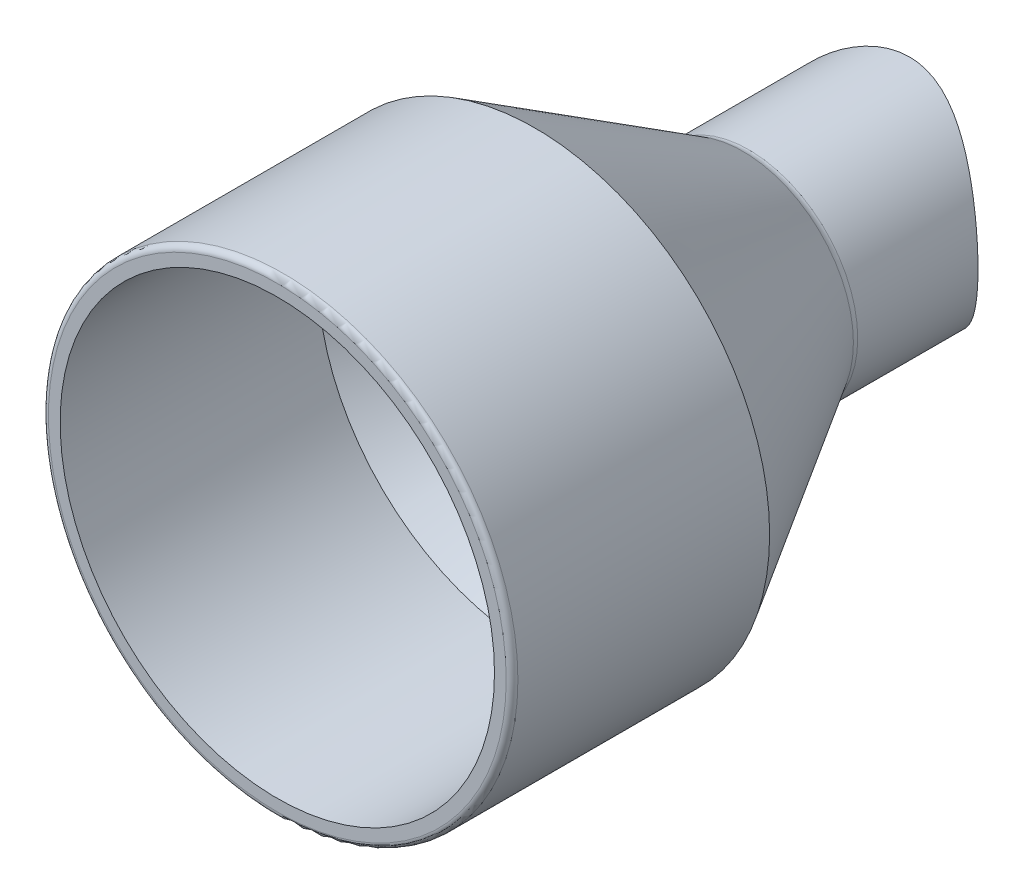
from build123d import *
from build123d.topology import SkipClean

# Parameters (mm, degrees)
SKETCH1_R               = 20.05
SKETCH1_R_2             = 18.55
BOSS_EXTRUDE1_DEPTH     = 22
FILLET1_R               = 0.5
CUT_EXTRUDE1_DEPTH      = 10
CUT_EXTRUDE1_DEPTH_BACK = 10
SKETCH6_R               = 14.25
BOSS_EXTRUDE2_START     = -40
BOSS_EXTRUDE2_DEPTH     = 6
CHAMFER1_SIZE           = 1
FILLET2_R               = 1
FILLET3_R               = 1
FILLET4_R               = 1


with BuildPart() as part:
    # Sketch1 → Boss-Extrude1 (new body)
    with BuildSketch(Plane.XY):
        Circle(SKETCH1_R)
        Circle(SKETCH1_R_2, mode=Mode.SUBTRACT)
    extrude(amount=BOSS_EXTRUDE1_DEPTH)

    # Fillet1
    fillet1_edges = [part.edges().sort_by_distance(p)[0] for p in [
        (-20.05, 0, 22),
    ]]
    fillet(fillet1_edges, radius=FILLET1_R)

    # Sketch5 → Revolve1 (revolve)
    with BuildSketch(Plane(origin=(0, 0, 0), x_dir=(0, 0, -1), z_dir=(1, 0, 0))):
        Polygon((0, 18.55), (18, 7.8), (32, 7.8), (32, 9.3), (18, 9.3), (0, 20.05), align=None)
    revolve(axis=Axis((0, 0, 0), (0, 0, -1)))

    # Sketch6 → Cut-Extrude1 (cut, two sides: drawn at the far end of the back side and taken through both)
    with BuildSketch(Plane(origin=(0, 0, 0), x_dir=(0, 0, -1), z_dir=(1, 0, 0)).offset(-CUT_EXTRUDE1_DEPTH_BACK)):
        with Locations((42.796874548, 0)):
            Circle(SKETCH6_R)
    extrude(amount=CUT_EXTRUDE1_DEPTH + CUT_EXTRUDE1_DEPTH_BACK, mode=Mode.SUBTRACT)

    # Sketch7 → Boss-Extrude2 (add)
    with SkipClean():  # the faces are left unmerged after this step: merging them gives an invalid solid
        with BuildSketch(Plane.XY.offset(22).offset(BOSS_EXTRUDE2_START)):
            with BuildLine():
                Line((-9.246080251, -1), (-6.3, -1))
                Line((-6.3, -1), (-6.3, 1))
                Line((-6.3, 1), (-9.246080251, 1))
                ThreePointArc((-9.246080251, 1), (-9.3, 0), (-9.246080251, -1))
            make_face()
            with BuildLine():
                Line((6.3, -1), (9.246080251, -1))
                ThreePointArc((9.246080251, -1), (9.3, 0), (9.246080251, 1))
                Line((9.246080251, 1), (6.3, 1))
                Line((6.3, 1), (6.3, -1))
            make_face()
        extrude(amount=-BOSS_EXTRUDE2_DEPTH)

    # Chamfer1
    chamfer1_edges = [part.edges().sort_by_distance(p)[0] for p in [
        (-6.3, 0, -24),
        (6.3, 0, -24),
    ]]
    chamfer(chamfer1_edges, length=CHAMFER1_SIZE)

    # Fillet2
    fillet2_edges = [part.edges().sort_by_distance(p)[0] for p in [
        (0, -7.8, -18),
    ]]
    fillet(fillet2_edges, radius=FILLET2_R)
    fillet2_2_edges = [part.edges().sort_by_distance(p)[0] for p in [
        (-5.149757276, 5.858327406, -18),
        (5.149757276, 5.858327406, -18),
    ]]
    fillet(fillet2_2_edges, radius=FILLET2_R)

    # Fillet3
    fillet3_edges = [part.edges().sort_by_distance(p)[0] for p in [
        (6.3, 0, -18),
        (-6.3, 0, -18),
    ]]
    fillet(fillet3_edges, radius=FILLET3_R)

    # Fillet4
    fillet4_edges = [part.edges().sort_by_distance(p)[0] for p in [
        (9.3, 0, -18),
    ]]
    fillet(fillet4_edges, radius=FILLET4_R)


solid = part.part
